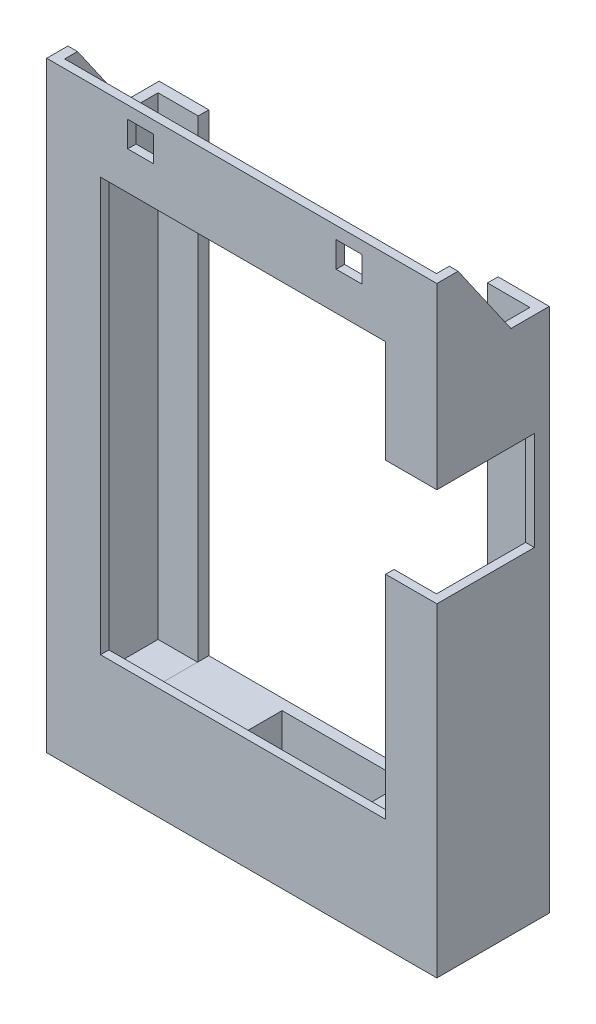
from build123d import *

# Parameters (mm, degrees)
BOSS_EXTRUDE2_DEPTH      = 34.479411165
BOSS_EXTRUDE2_DEPTH_BACK = 0.1
SKETCH4_W                = 120
SKETCH4_H                = 185
SKETCH7_W                = 88.965159514
SKETCH7_H                = 168.79001582
CUT_EXTRUDE1_DEPTH       = 32
SKETCH8_W                = 38.11885966
SKETCH8_H                = 26.011926246
CUT_EXTRUDE2_DEPTH       = 32
SKETCH12_W               = 12.33668545
SKETCH12_H               = 28.735157877
SKETCH12_W_2             = 13.054734016
CUT_EXTRUDE10_DEPTH      = 169
CUT_EXTRUDE11_DEPTH      = 156.38687137
CUT_EXTRUDE11_DEPTH_BACK = 120
SKETCH14_W               = 7.893435911
SKETCH14_H               = 7.893435911
SKETCH14_W_2             = 7.893435912
CUT_EXTRUDE13_DEPTH      = 120
SKETCH16_W               = 16.234881207
SKETCH16_H               = 30.372514135
CUT_EXTRUDE15_DEPTH      = 30
SKETCH18_W               = 87.696314575
SKETCH18_H               = 127.234716822
CUT_EXTRUDE20_DEPTH      = 10


with BuildPart() as part:
    # Sketch4 → Boss-Extrude2 (new, two sides: drawn at the far end of the back side and taken through both)
    with BuildSketch(Plane.XY.offset(-BOSS_EXTRUDE2_DEPTH_BACK)):
        Rectangle(SKETCH4_W, SKETCH4_H)
    extrude(amount=BOSS_EXTRUDE2_DEPTH + BOSS_EXTRUDE2_DEPTH_BACK)

    # Sketch7 → Cut-Extrude1 (cut)
    with BuildSketch(Plane(origin=(0, 0, -0.1), x_dir=(-1, 0, 0), z_dir=(0, 0, -1))):
        with Locations((0.239153655, 8.10499209)):
            Rectangle(SKETCH7_W, SKETCH7_H)
    extrude(amount=-CUT_EXTRUDE1_DEPTH, mode=Mode.SUBTRACT)

    # Sketch8 → Cut-Extrude2 (cut)
    with BuildSketch(Plane(origin=(0, -76.29001582, 0), x_dir=(1, 0, 0), z_dir=(0, 1, 0))):
        with Locations((0.239741256, -16.26190688)):
            Rectangle(SKETCH8_W, SKETCH8_H)
    extrude(amount=-CUT_EXTRUDE2_DEPTH, mode=Mode.SUBTRACT)

    # Sketch12 → Cut-Extrude10 (cut)
    with BuildSketch(Plane(origin=(0, 92.5, 0), x_dir=(1, 0, 0), z_dir=(0, 1, 0))):
        with Locations((-50.890076137, -17.532421062)):
            Rectangle(SKETCH12_W, SKETCH12_H)
        with Locations((50.77079311, -17.532421062)):
            Rectangle(SKETCH12_W_2, SKETCH12_H)
    extrude(amount=-CUT_EXTRUDE10_DEPTH, mode=Mode.SUBTRACT)

    # Sketch13 → Cut-Extrude11 (cut, two sides: drawn at the far end of the back side and taken through both)
    with BuildSketch(Plane(origin=(60, 0, 0), x_dir=(0, 0, -1), z_dir=(1, 0, 0)).offset(-CUT_EXTRUDE11_DEPTH_BACK)):
        Polygon((-247.325576021, 407.948170503), (-27.952099996, 92.5), (-11.689651482, 69.115406181), (0.1, 69.115406181), (384.329450013, 69.115406181), (747.583784475, 746.297338547), (115.928758441, 1085.130102868), align=None)
    extrude(amount=CUT_EXTRUDE11_DEPTH + CUT_EXTRUDE11_DEPTH_BACK, mode=Mode.SUBTRACT)

    # Sketch14 → Cut-Extrude13 (cut)
    with BuildSketch(Plane(origin=(0, 0, 31.9), x_dir=(-1, 0, 0), z_dir=(0, 0, -1))):
        with Locations((-32.983285774, 84.758555925)):
            Rectangle(SKETCH14_W, SKETCH14_H)
        with Locations((31.155523105, 84.758555925)):
            Rectangle(SKETCH14_W_2, SKETCH14_H)
    extrude(amount=-CUT_EXTRUDE13_DEPTH, mode=Mode.SUBTRACT)

    # Sketch16 → Cut-Extrude15 (cut)
    with BuildSketch(Plane.XY.offset(34.479411165)):
        with Locations((51.882559396, 22.360866706)):
            Rectangle(SKETCH16_W, SKETCH16_H)
    extrude(amount=-CUT_EXTRUDE15_DEPTH, mode=Mode.SUBTRACT)

    # Sketch18 → Cut-Extrude20 (cut)
    with BuildSketch(Plane.XY.offset(34.479411165)):
        with Locations((0.395268814, 5.49804777)):
            Rectangle(SKETCH18_W, SKETCH18_H)
    extrude(amount=-CUT_EXTRUDE20_DEPTH, mode=Mode.SUBTRACT)


solid = part.part
